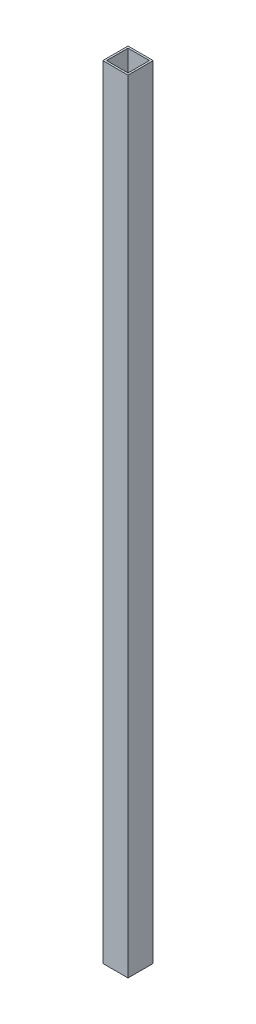
from build123d import *

# Parameters (mm, degrees)
SKETCH1_W           = 40
SKETCH1_H           = 40
BOSS_EXTRUDE1_DEPTH = 1240
SKETCH2_W           = 34
SKETCH2_H           = 34
CUT_EXTRUDE1_DEPTH  = 1241.322538697


with BuildPart() as part:
    # Sketch1 → Boss-Extrude1 (new body)
    with BuildSketch(Plane(origin=(0, 0, 0), x_dir=(1, 0, 0), z_dir=(0, 1, 0))):
        Rectangle(SKETCH1_W, SKETCH1_H)
    extrude(amount=BOSS_EXTRUDE1_DEPTH)

    # Sketch2 → Cut-Extrude1 (cut, through all)
    with BuildSketch(Plane(origin=(0, 1240, 0), x_dir=(1, 0, 0), z_dir=(0, 1, 0))):
        Rectangle(SKETCH2_W, SKETCH2_H)
    extrude(amount=-CUT_EXTRUDE1_DEPTH, mode=Mode.SUBTRACT)


solid = part.part
